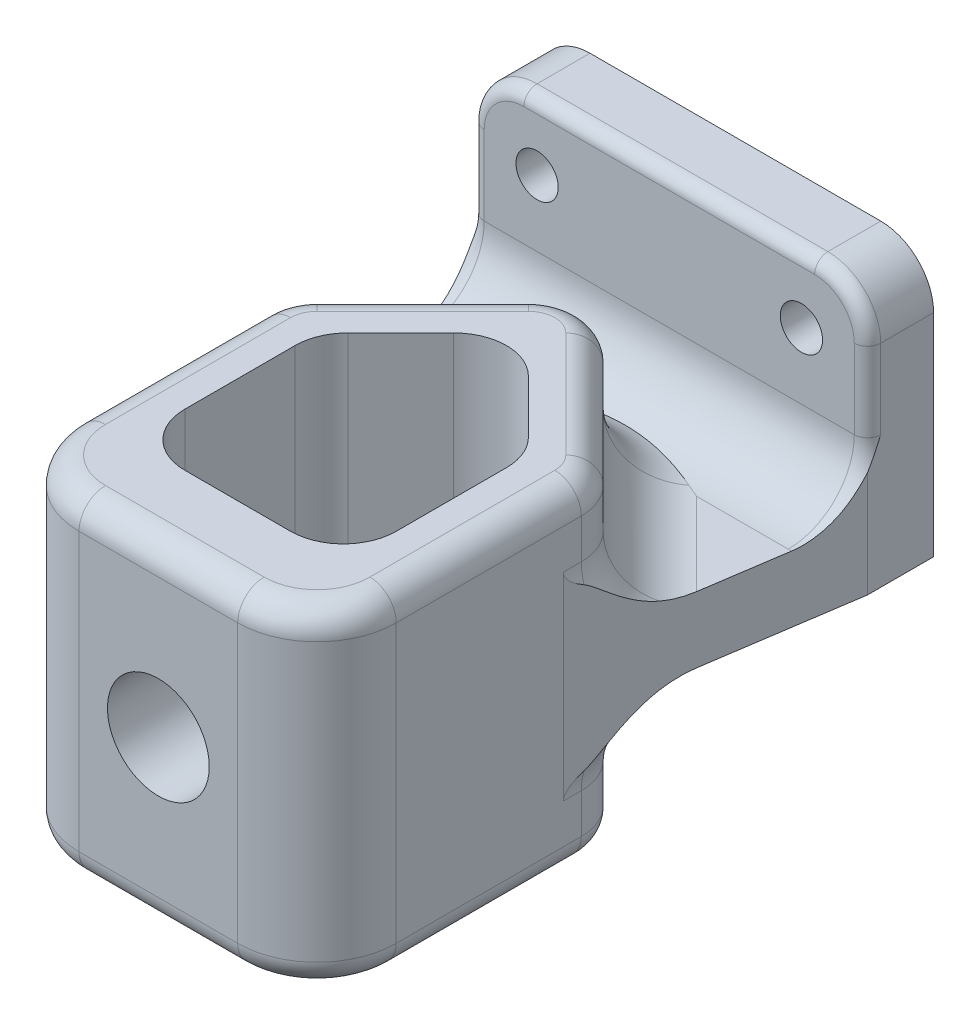
from build123d import *

# Parameters (mm, degrees)
SKETCH_1_W               = 30
SKETCH_1_H               = 15
SKETCH_1_R               = 1.6
EXTRUDE_1_DEPTH          = 5
EXTRUDE_2_DEPTH          = 5
EXTRUDE_START            = -15
EXTRUDE_3_DEPTH          = 25
CUT_EXTRUDE_1_REACH      = 53.353
SKETCH_5_R               = 3.85
CUT_EXTRUDE_3_DEPTH      = 53.496865839
CUT_EXTRUDE_3_DEPTH_BACK = 53.496865839
FILLET_1_R               = 4
FILLET_2_R               = 6
FILLET_3_R               = 2
FILLET_4_R               = 4
FILLET_9_R               = 1
FILLET_10_R              = 5


with BuildPart() as part:
    # 草图1 → 凸台-拉伸1 (new body)
    with BuildSketch(Plane.XY):
        Rectangle(SKETCH_1_W, SKETCH_1_H)
        with Locations((-10, 2.5)):
            Circle(SKETCH_1_R, mode=Mode.SUBTRACT)
        with Locations(Location((10, 2.5, 0), (0, 0, 180))):
            Circle(SKETCH_1_R, mode=Mode.SUBTRACT)
    extrude(amount=EXTRUDE_1_DEPTH)

    # 草图3 → 凸台-拉伸2 (add)
    with BuildSketch(Plane.XZ.offset(7.5)):
        Polygon((-15, 0), (15, 0), (15, 5), (12, 25), (-12, 25), (-15, 5), align=None)
    extrude(amount=EXTRUDE_2_DEPTH)

    # 草图4 → 凸台-拉伸3 (add)
    with BuildSketch(Plane(origin=(0, -7.5, 0), x_dir=(1, 0, 0), z_dir=(0, 1, 0)).offset(EXTRUDE_START)):
        Polygon((0, -10), (12, -22), (12, -43.656854249), (-12, -43.656854249), (-12, -22), align=None)
        Polygon((8, -37.656854249), (-8, -37.656854249), (-8, -23.656854249), (0, -15.656854249), (8, -23.656854249), align=None, mode=Mode.SUBTRACT)
    extrude(amount=EXTRUDE_3_DEPTH)

    # 草图5 → 切除-拉伸1 (cut, up to next)
    with BuildSketch(Plane.XY.offset(43.656854249), mode=Mode.PRIVATE) as cut_extrude_1_sk1:
        with Locations((0, -10)):
            Circle(SKETCH_5_R)
    cut_extrude_1_tool1 = extrude(cut_extrude_1_sk1.sketch, amount=-CUT_EXTRUDE_1_REACH, mode=Mode.PRIVATE) & part.part
    add(cut_extrude_1_tool1.solids().sort_by_distance((0, -10, 43.656854))[0], mode=Mode.SUBTRACT)

    # 草图7 → 切除-拉伸3 (cut, two sides: drawn at the far end of the back side and taken through both)
    with BuildSketch(Plane(origin=(0, 2.5, 0), x_dir=(1, 0, 0), z_dir=(0, 1, 0)).offset(-CUT_EXTRUDE_3_DEPTH_BACK)):
        Polygon((-8, -23.656854249), (-8, -25), (8, -25), (8, -23.656854249), (0, -15.656854249), align=None)
    extrude(amount=CUT_EXTRUDE_3_DEPTH + CUT_EXTRUDE_3_DEPTH_BACK, mode=Mode.SUBTRACT)

    # 圆角1
    fillet_1_edges = [part.edges().sort_by_distance(p)[0] for p in [
        (-12, -2.5, 22),
        (0, -2.5, 10),
        (0, -10, 15.656854249),
        (8, -10, 23.656854249),
        (-12, -17.5, 22),
        (0, -17.5, 10),
        (12, -17.5, 22),
        (12, -2.5, 22),
        (8, -10, 37.656854249),
        (-8, -10, 37.656854249),
        (-8, -10, 23.656854249),
    ]]
    fillet(fillet_1_edges, radius=FILLET_1_R)

    # 圆角2
    fillet_2_edges = [part.edges().sort_by_distance(p)[0] for p in [
        (12, -10, 43.656854249),
        (-12, -10, 43.656854249),
    ]]
    fillet(fillet_2_edges, radius=FILLET_2_R)

    # 圆角3
    fillet_3_edges = [part.edges().sort_by_distance(p)[0] for p in [
        (-6.828427125, -22.5, 16.828427125),
        (-12, -22.5, 30.656854249),
        (-12, 2.5, 30.656854249),
        (6.828427125, -22.5, 16.828427125),
        (0, -22.5, 11.656854249),
        (11.69551813, -22.5, 22.12612052),
        (-11.69551813, -22.5, 22.12612052),
        (-6.828427125, 2.5, 16.828427125),
        (6.828427125, 2.5, 16.828427125),
        (0, 2.5, 11.656854249),
        (11.69551813, 2.5, 22.12612052),
        (-11.69551813, 2.5, 22.12612052),
        (0, -22.5, 43.656854249),
        (0, 2.5, 43.656854249),
        (12, 2.5, 30.656854249),
        (-10.242640687, 2.5, 41.899494937),
        (10.242640687, 2.5, 41.899494937),
        (12, -22.5, 30.656854249),
        (-10.242640687, -22.5, 41.899494937),
        (10.242640687, -22.5, 41.899494937),
    ]]
    fillet(fillet_3_edges, radius=FILLET_3_R)

    # 圆角4
    fillet_4_edges = [part.edges().sort_by_distance(p)[0] for p in [
        (-15, 7.5, 2.5),
        (15, 7.5, 2.5),
    ]]
    fillet(fillet_4_edges, radius=FILLET_4_R)

    # 圆角9
    fillet_9_edges = [part.edges().sort_by_distance(p)[0] for p in [
        (0, 7.5, 5),
        (-15, -2, 5),
        (-13.828427125, 6.328427125, 5),
        (13.828427125, 6.328427125, 5),
        (15, -2, 5),
    ]]
    fillet(fillet_9_edges, radius=FILLET_9_R)

    # 圆角10
    # the kernel refuses this fillet: 5 mm, written as the material it adds along each edge
    with BuildSketch(Plane(origin=(-12, -7.5, 37.5), x_dir=(-1, 0, 0), z_dir=(0, 0, -1))) as fillet_10_piece_1_section:
        with BuildLine():
            CenterArc((FILLET_10_R, FILLET_10_R), FILLET_10_R, 180, 90)
            Line((0, FILLET_10_R), (0, 0))
            Line((0, 0), (FILLET_10_R, 0))
        make_face()
    fillet_10_piece_1 = extrude(amount=13.843145751, mode=Mode.PRIVATE)
    fillet_10_piece_1 = split(fillet_10_piece_1, bisect_by=Plane(origin=(-12.131106439, -5.365485475, 24.125957074), z_dir=(0.9889363528682976, 0, -0.14834045293024392)), keep=Keep.TOP, mode=Mode.PRIVATE)
    add(fillet_10_piece_1)
    with BuildSketch(Plane(origin=(12, -7.5, 23.656854249), x_dir=(1, 0, 0), z_dir=(0, 0, 1))) as fillet_10_piece_2_section:
        with BuildLine():
            CenterArc((FILLET_10_R, FILLET_10_R), FILLET_10_R, 180, 90)
            Line((0, FILLET_10_R), (0, 0))
            Line((0, 0), (FILLET_10_R, 0))
        make_face()
    fillet_10_piece_2 = extrude(amount=13.843145751, mode=Mode.PRIVATE)
    fillet_10_piece_2 = split(fillet_10_piece_2, bisect_by=Plane(origin=(12.131106439, -5.365485475, 24.125957074), z_dir=(-0.9889363528682976, 0, -0.14834045293024423)), keep=Keep.TOP, mode=Mode.PRIVATE)
    add(fillet_10_piece_2)
    with BuildSketch(Plane(origin=(2.828427125, -7.5, 12.828427125), x_dir=(0.7071067811865546, 0, -0.7071067811865405), z_dir=(0.7071067811865405, 0, 0.7071067811865547))) as fillet_10_piece_3_section:
        with BuildLine():
            CenterArc((FILLET_10_R, FILLET_10_R), FILLET_10_R, 180, 90)
            Line((0, FILLET_10_R), (0, 0))
            Line((0, 0), (FILLET_10_R, 0))
        make_face()
    fillet_10_piece_3 = extrude(amount=11.313708499, mode=Mode.PRIVATE)
    fillet_10_piece_3 = split(fillet_10_piece_3, bisect_by=Plane(origin=(13.218453032, -6.381417365, 16.876979785), z_dir=(-0.9889363528682976, 0, -0.14834045293024423)), keep=Keep.TOP, mode=Mode.PRIVATE)
    add(fillet_10_piece_3)
    with BuildSketch(Plane(origin=(0, -7.5, 15.656854249), x_dir=(0.7071067811865549, 0, -0.7071067811865404), z_dir=(0.7071067811865404, 0, 0.7071067811865549))) as fillet_10_piece_4:
        with BuildLine():
            CenterArc((4 + FILLET_10_R, FILLET_10_R), FILLET_10_R, 180, 90)
            Line((4, FILLET_10_R), (4, 0))
            Line((4, 0), (4 + FILLET_10_R, 0))
        make_face()
    revolve(axis=Axis((0, -7.5, 15.656854249), (0, 1, 0)), revolution_arc=90)
    with BuildSketch(Plane(origin=(-12, -12.5, 37.5), x_dir=(-1, 0, 0), z_dir=(0, 0, -1))) as fillet_10_piece_5_section:
        with BuildLine():
            CenterArc((FILLET_10_R, -FILLET_10_R), FILLET_10_R, 90, 90)
            Line((0, -FILLET_10_R), (0, 0))
            Line((0, 0), (FILLET_10_R, 0))
        make_face()
    fillet_10_piece_5 = extrude(amount=13.843145751, mode=Mode.PRIVATE)
    fillet_10_piece_5 = split(fillet_10_piece_5, bisect_by=Plane(origin=(-12.131106439, -14.634514525, 24.125957074), z_dir=(0.9889363528682976, 0, -0.14834045293024392)), keep=Keep.TOP, mode=Mode.PRIVATE)
    add(fillet_10_piece_5)
    with BuildSketch(Plane(origin=(12, -12.5, 23.656854249), x_dir=(1, 0, 0), z_dir=(0, 0, 1))) as fillet_10_piece_6_section:
        with BuildLine():
            CenterArc((FILLET_10_R, -FILLET_10_R), FILLET_10_R, 90, 90)
            Line((0, -FILLET_10_R), (0, 0))
            Line((0, 0), (FILLET_10_R, 0))
        make_face()
    fillet_10_piece_6 = extrude(amount=13.843145751, mode=Mode.PRIVATE)
    fillet_10_piece_6 = split(fillet_10_piece_6, bisect_by=Plane(origin=(12.131106439, -14.634514525, 24.125957074), z_dir=(-0.9889363528682976, 0, -0.14834045293024423)), keep=Keep.TOP, mode=Mode.PRIVATE)
    add(fillet_10_piece_6)
    with BuildSketch(Plane(origin=(2.828427125, -12.5, 12.828427125), x_dir=(0.7071067811865546, 0, -0.7071067811865404), z_dir=(0.7071067811865405, 0, 0.7071067811865547))) as fillet_10_piece_7_section:
        with BuildLine():
            CenterArc((FILLET_10_R, -FILLET_10_R), FILLET_10_R, 90, 90)
            Line((0, -FILLET_10_R), (0, 0))
            Line((0, 0), (FILLET_10_R, 0))
        make_face()
    fillet_10_piece_7 = extrude(amount=11.313708499, mode=Mode.PRIVATE)
    fillet_10_piece_7 = split(fillet_10_piece_7, bisect_by=Plane(origin=(13.218453032, -13.618582635, 16.876979785), z_dir=(-0.9889363528682976, 0, -0.14834045293024423)), keep=Keep.TOP, mode=Mode.PRIVATE)
    add(fillet_10_piece_7)
    with BuildSketch(Plane(origin=(0, -12.5, 15.656854249), x_dir=(0.7071067811865549, 0, -0.7071067811865404), z_dir=(0.7071067811865404, 0, 0.7071067811865549))) as fillet_10_piece_8:
        with BuildLine():
            CenterArc((4 + FILLET_10_R, -FILLET_10_R), FILLET_10_R, 90, 90)
            Line((4, -FILLET_10_R), (4, 0))
            Line((4, 0), (4 + FILLET_10_R, 0))
        make_face()
    revolve(axis=Axis((0, -12.5, 15.656854249), (0, 1, 0)), revolution_arc=90)
    with BuildSketch(Plane(origin=(-14, -7.5, 4), x_dir=(0, 0, 1), z_dir=(1, 0, 0))) as fillet_10_piece_9_section:
        with BuildLine():
            CenterArc((1 + FILLET_10_R, -FILLET_10_R), FILLET_10_R, 90, 90)
            Line((1 + FILLET_10_R, 0), (1, 0))
            Line((1, 0), (1, -FILLET_10_R))
        make_face()
    fillet_10_piece_9 = revolve(axis=Axis((-14, -7.5, 4), (0, -1, 0)), revolution_arc=359.64, mode=Mode.PRIVATE)
    fillet_10_piece_9 = split(fillet_10_piece_9, bisect_by=Plane(origin=(-15, -5.48235467, 4.767475024), z_dir=(1, 0, 0)), keep=Keep.TOP, mode=Mode.PRIVATE)
    fillet_10_piece_9 = split(fillet_10_piece_9, bisect_by=Plane(origin=(-14.767475023, -5.48235467, 0), z_dir=(0, 0, 1)), keep=Keep.TOP, mode=Mode.PRIVATE)
    fillet_10_piece_9 = split(fillet_10_piece_9, bisect_by=Plane(origin=(-15.028994557, -5.48235467, 4.806702954), z_dir=(0.9889363528682976, 0, -0.14834045293024392)), keep=Keep.TOP, mode=Mode.PRIVATE)
    add(fillet_10_piece_9)
    with BuildSketch(Plane(origin=(14, -7.5, 4), x_dir=(0, 0, 1), z_dir=(-1, 0, 0))) as fillet_10_piece_10_section:
        with BuildLine():
            CenterArc((1 + FILLET_10_R, FILLET_10_R), FILLET_10_R, 180, 90)
            Line((1, FILLET_10_R), (1, 0))
            Line((1, 0), (1 + FILLET_10_R, 0))
        make_face()
    fillet_10_piece_10 = revolve(axis=Axis((14, -7.5, 4), (0, 1, 0)), revolution_arc=359.64, mode=Mode.PRIVATE)
    fillet_10_piece_10 = split(fillet_10_piece_10, bisect_by=Plane(origin=(14.413021761, -6.394485082, 0), z_dir=(0, 0, 1)), keep=Keep.TOP, mode=Mode.PRIVATE)
    fillet_10_piece_10 = split(fillet_10_piece_10, bisect_by=Plane(origin=(15, -6.394485082, 5.985808303), z_dir=(-1, 0, 0)), keep=Keep.TOP, mode=Mode.PRIVATE)
    fillet_10_piece_10 = split(fillet_10_piece_10, bisect_by=Plane(origin=(14.842466253, -6.394485082, 6.050224977), z_dir=(-0.9889363528682976, 0, -0.14834045293024423)), keep=Keep.TOP, mode=Mode.PRIVATE)
    add(fillet_10_piece_10)
    with BuildSketch(Plane(origin=(-10.828427125, -7.5, 20.828427125), x_dir=(-0.7071067811865444, 0, -0.7071067811865507), z_dir=(0.7071067811865508, 0, -0.7071067811865444))) as fillet_10_piece_11_section:
        with BuildLine():
            CenterArc((FILLET_10_R, FILLET_10_R), FILLET_10_R, 180, 90)
            Line((0, FILLET_10_R), (0, 0))
            Line((0, 0), (FILLET_10_R, 0))
        make_face()
    fillet_10_piece_11 = extrude(amount=11.313708499, mode=Mode.PRIVATE)
    fillet_10_piece_11 = split(fillet_10_piece_11, bisect_by=Plane(origin=(-13.218453032, -6.381417365, 16.876979785), z_dir=(0.9889363528682976, 0, -0.14834045293024392)), keep=Keep.TOP, mode=Mode.PRIVATE)
    add(fillet_10_piece_11)
    with BuildSketch(Plane(origin=(-10.828427125, -12.5, 20.828427125), x_dir=(-0.7071067811865442, 0, -0.7071067811865508), z_dir=(0.7071067811865508, 0, -0.7071067811865444))) as fillet_10_piece_12_section:
        with BuildLine():
            CenterArc((FILLET_10_R, -FILLET_10_R), FILLET_10_R, 90, 90)
            Line((0, -FILLET_10_R), (0, 0))
            Line((0, 0), (FILLET_10_R, 0))
        make_face()
    fillet_10_piece_12 = extrude(amount=11.313708499, mode=Mode.PRIVATE)
    fillet_10_piece_12 = split(fillet_10_piece_12, bisect_by=Plane(origin=(-13.218453032, -13.618582635, 16.876979785), z_dir=(0.9889363528682976, 0, -0.14834045293024392)), keep=Keep.TOP, mode=Mode.PRIVATE)
    add(fillet_10_piece_12)
    with BuildSketch(Plane(origin=(-14, -7.5, 5), x_dir=(0, 0, 1), z_dir=(1, 0, 0))) as fillet_10_piece_13:
        with BuildLine():
            CenterArc((FILLET_10_R, -FILLET_10_R), FILLET_10_R, 90, 90)
            Line((0, -FILLET_10_R), (0, 0))
            Line((0, 0), (FILLET_10_R, 0))
        make_face()
    extrude(amount=28)
    with BuildSketch(Plane(origin=(-8, -12.5, 23.656854249), x_dir=(-1, 0, 0), z_dir=(0, 0, 1))) as fillet_10_piece_14_section:
        with BuildLine():
            CenterArc((4 + FILLET_10_R, FILLET_10_R), FILLET_10_R, 180, 90)
            Line((4, FILLET_10_R), (4, 0))
            Line((4, 0), (4 + FILLET_10_R, 0))
        make_face()
    fillet_10_piece_14 = revolve(axis=Axis((-8, -12.5, 23.656854249), (0, -1, 0)), revolution_arc=45, mode=Mode.PRIVATE)
    fillet_10_piece_14 = split(fillet_10_piece_14, bisect_by=Plane(origin=(-12.615752224, -13.436487527, 20.894985171), z_dir=(0.9889363528682976, 0, -0.14834045293024392)), keep=Keep.TOP, mode=Mode.PRIVATE)
    add(fillet_10_piece_14)
    with BuildSketch(Plane(origin=(-8, -7.5, 23.656854249), x_dir=(-1, 0, 0), z_dir=(0, 0, 1))) as fillet_10_piece_15_section:
        with BuildLine():
            CenterArc((4 + FILLET_10_R, -FILLET_10_R), FILLET_10_R, 90, 90)
            Line((4, -FILLET_10_R), (4, 0))
            Line((4, 0), (4 + FILLET_10_R, 0))
        make_face()
    fillet_10_piece_15 = revolve(axis=Axis((-8, -7.5, 23.656854249), (0, -1, 0)), revolution_arc=45, mode=Mode.PRIVATE)
    fillet_10_piece_15 = split(fillet_10_piece_15, bisect_by=Plane(origin=(-12.615752224, -6.563512473, 20.894985171), z_dir=(0.9889363528682976, 0, -0.14834045293024392)), keep=Keep.TOP, mode=Mode.PRIVATE)
    add(fillet_10_piece_15)
    with BuildSketch(Plane(origin=(8, -12.5, 23.656854249), x_dir=(1, 0, 0), z_dir=(0, 0, 1))) as fillet_10_piece_16_section:
        with BuildLine():
            CenterArc((4 + FILLET_10_R, -FILLET_10_R), FILLET_10_R, 90, 90)
            Line((4, -FILLET_10_R), (4, 0))
            Line((4, 0), (4 + FILLET_10_R, 0))
        make_face()
    fillet_10_piece_16 = revolve(axis=Axis((8, -12.5, 23.656854249), (0, 1, 0)), revolution_arc=45, mode=Mode.PRIVATE)
    fillet_10_piece_16 = split(fillet_10_piece_16, bisect_by=Plane(origin=(12.615752224, -13.436487526, 20.894985172), z_dir=(-0.9889363528682976, 0, -0.14834045293024423)), keep=Keep.TOP, mode=Mode.PRIVATE)
    add(fillet_10_piece_16)
    with BuildSketch(Plane(origin=(8, -7.5, 23.656854249), x_dir=(1, 0, 0), z_dir=(0, 0, 1))) as fillet_10_piece_17_section:
        with BuildLine():
            CenterArc((4 + FILLET_10_R, FILLET_10_R), FILLET_10_R, 180, 90)
            Line((4, FILLET_10_R), (4, 0))
            Line((4, 0), (4 + FILLET_10_R, 0))
        make_face()
    fillet_10_piece_17 = revolve(axis=Axis((8, -7.5, 23.656854249), (0, 1, 0)), revolution_arc=45, mode=Mode.PRIVATE)
    fillet_10_piece_17 = split(fillet_10_piece_17, bisect_by=Plane(origin=(12.615752224, -6.563512474, 20.894985171), z_dir=(-0.9889363528682976, 0, -0.14834045293024423)), keep=Keep.TOP, mode=Mode.PRIVATE)
    add(fillet_10_piece_17)


solid = part.part
